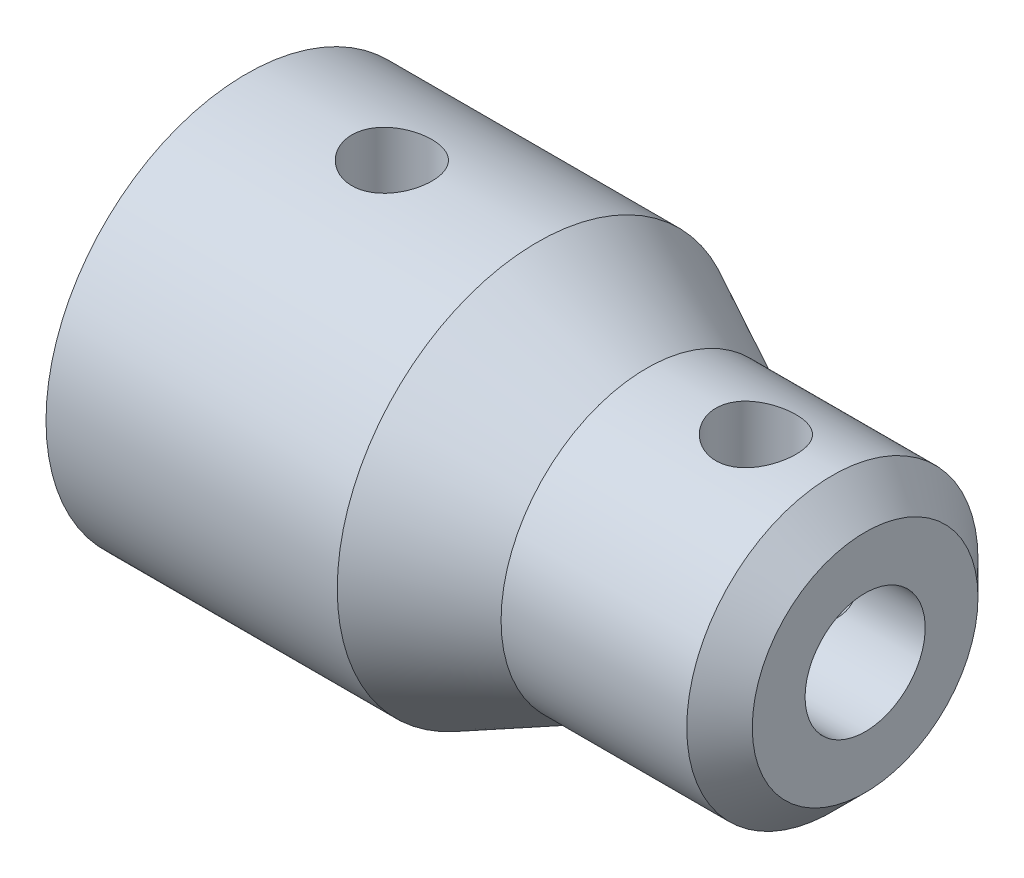
from build123d import *

# Parameters (mm, degrees)
SKETCH2_R          = 1.397
CUT_EXTRUDE1_DEPTH = 16.107129112
CIRPATTERN1_COUNT  = 2
CIRPATTERN1_ANGLE  = 90
CHAMFER1_SIZE      = 1.143


with BuildPart() as part:
    # Sketch1 → Revolve1 (revolve)
    with BuildSketch(Plane(origin=(0, 0, 0), x_dir=(1, 0, 0), z_dir=(0, 1, 0))):
        Polygon((-10.16, 3.4036), (0, 3.4036), (1.905, 2.0955), (11.43, 2.0955), (11.43, 5.08), (3.81, 5.08), (0, 6.985), (-10.16, 6.985), align=None)
    revolve(axis=Axis((0, 0, 0), (1, 0, 0)))

    # Sketch2 → Cut-Extrude1 (cut, through all)
    with BuildSketch(Plane(origin=(0, 0, 0), x_dir=(1, 0, 0), z_dir=(0, 1, 0))):
        with Locations((-5.08, 0)):
            Circle(SKETCH2_R)
        with Locations((7.62, 0)):
            Circle(SKETCH2_R)
    cut_extrude1 = extrude(amount=CUT_EXTRUDE1_DEPTH, mode=Mode.SUBTRACT)

    # CirPattern1: Cut-Extrude1 ×2 about axis
    cirpattern1_axis = Axis((-10.16, 0, 0), (-1, 0, 0))
    for i in range(1, CIRPATTERN1_COUNT):
        add(cut_extrude1.rotate(cirpattern1_axis, i * CIRPATTERN1_ANGLE / (CIRPATTERN1_COUNT - 1)), mode=Mode.SUBTRACT)

    # Chamfer1
    chamfer1_edges = [part.edges().sort_by_distance(p)[0] for p in [
        (11.43, 0, 5.08),
    ]]
    chamfer(chamfer1_edges, length=CHAMFER1_SIZE)


solid = part.part
